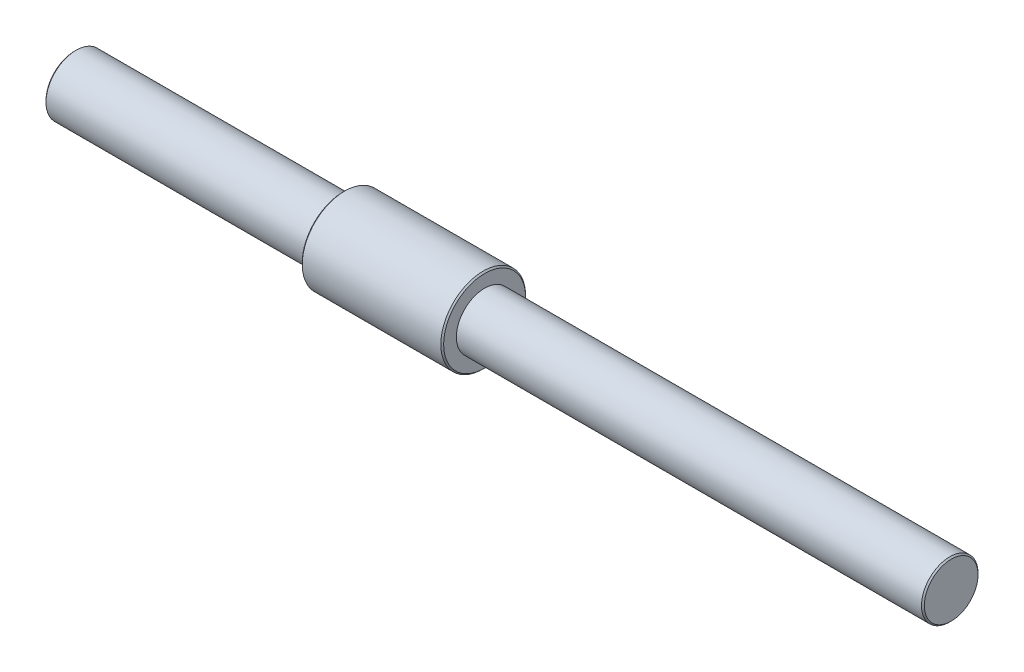
from build123d import *

# Parameters (mm, degrees)
CHAMFER1_SIZE = 0.1
CHAMFER3_SIZE = 0.1
CHAMFER4_SIZE = 0.1
CHAMFER5_SIZE = 0.1


with BuildPart() as part:
    # Sketch1 → Revolve1 (revolve)
    with BuildSketch(Plane.XY):
        Polygon((0, 0), (29, 0), (62, 0), (62, 2), (29, 2), (29, 3), (19, 3), (19, 2.125), (0, 2.125), align=None)
    revolve(axis=Axis((0, 0, 0), (1, 0, 0)))

    # Chamfer1
    chamfer1_edges = [part.edges().sort_by_distance(p)[0] for p in [
        (0, -2.125, 0),
    ]]
    chamfer(chamfer1_edges, length=CHAMFER1_SIZE)

    # Chamfer3
    chamfer3_edges = [part.edges().sort_by_distance(p)[0] for p in [
        (29, -3, 0),
    ]]
    chamfer(chamfer3_edges, length=CHAMFER3_SIZE)

    # Chamfer4
    chamfer4_edges = [part.edges().sort_by_distance(p)[0] for p in [
        (62, -2, 0),
    ]]
    chamfer(chamfer4_edges, length=CHAMFER4_SIZE)

    # Chamfer5
    chamfer5_edges = [part.edges().sort_by_distance(p)[0] for p in [
        (19, -3, 0),
    ]]
    chamfer(chamfer5_edges, length=CHAMFER5_SIZE)


solid = part.part
